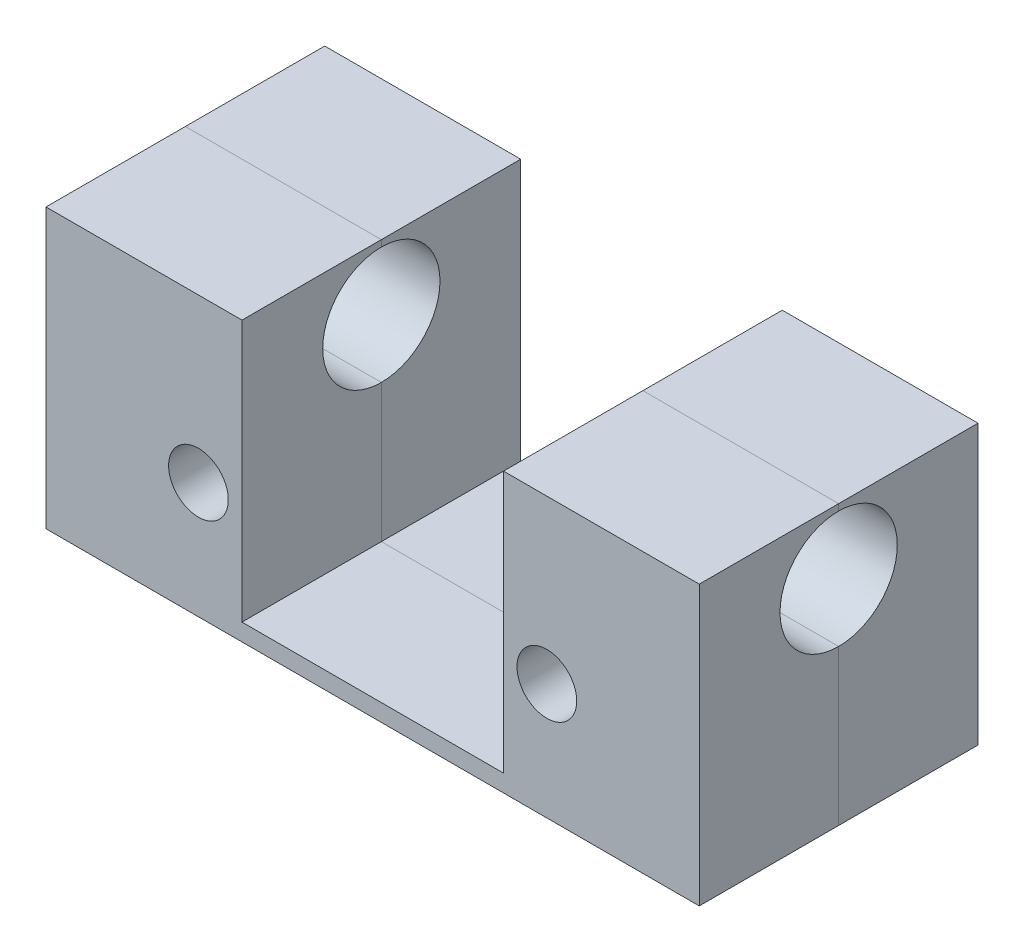
from build123d import *

# Parameters (mm, degrees)
SKETCH1_W                = 71.4375
SKETCH1_H                = 30.48
BOSS_EXTRUDE1_DEPTH      = 30.48
SKETCH4_W                = 28.6004
SKETCH4_H                = 28.6004
CUT_EXTRUDE1_DEPTH       = 31.496
SKETCH9_R                = 6.41140629
CUT_EXTRUDE2_DEPTH       = 74.168
F_5_16_18_TAPPED_HOLE1_D = 6.5278


# Read off the part's stored shape, not the designer's step: Split3
with BuildPart() as part:
    # Sketch1 → Boss-Extrude1 (new body)
    with BuildSketch(Plane(origin=(0, 0, 0), x_dir=(1, 0, 0), z_dir=(0, 1, 0))):
        Rectangle(SKETCH1_W, SKETCH1_H)
    extrude(amount=BOSS_EXTRUDE1_DEPTH)

    # Sketch4 → Cut-Extrude1 (cut)
    with BuildSketch(Plane.XY.offset(15.24)):
        with Locations((0.0127, 16.1798)):
            Rectangle(SKETCH4_W, SKETCH4_H)
    extrude(amount=-CUT_EXTRUDE1_DEPTH, mode=Mode.SUBTRACT)

    # Sketch9 → Cut-Extrude2 (cut)
    with BuildSketch(Plane(origin=(35.71875, 0, 0), x_dir=(0, 0, -1), z_dir=(1, 0, 0))):
        with Locations((0, 23.368)):
            Circle(SKETCH9_R)
    extrude(amount=-CUT_EXTRUDE2_DEPTH, mode=Mode.SUBTRACT)

    # 5/16-18 Tapped Hole1 (through all)
    with Locations(Plane(origin=(0, 0, -15.24), x_dir=(-1, 0, 0), z_dir=(0, 0, -1))):
        with Locations((-19.05, 12.7), (19.05, 12.7)):
            Hole(F_5_16_18_TAPPED_HOLE1_D / 2)


with BuildPart() as body_2:
    # Split3: the piece on the far side of the plane
    add(part.part)
    split(bisect_by=Plane.XY, keep=Keep.BOTTOM)


with BuildPart() as part_1:
    add(part.part)

    # Split3
    split(bisect_by=Plane.XY, keep=Keep.TOP)


solid = Compound([body_2.part, part_1.part])
